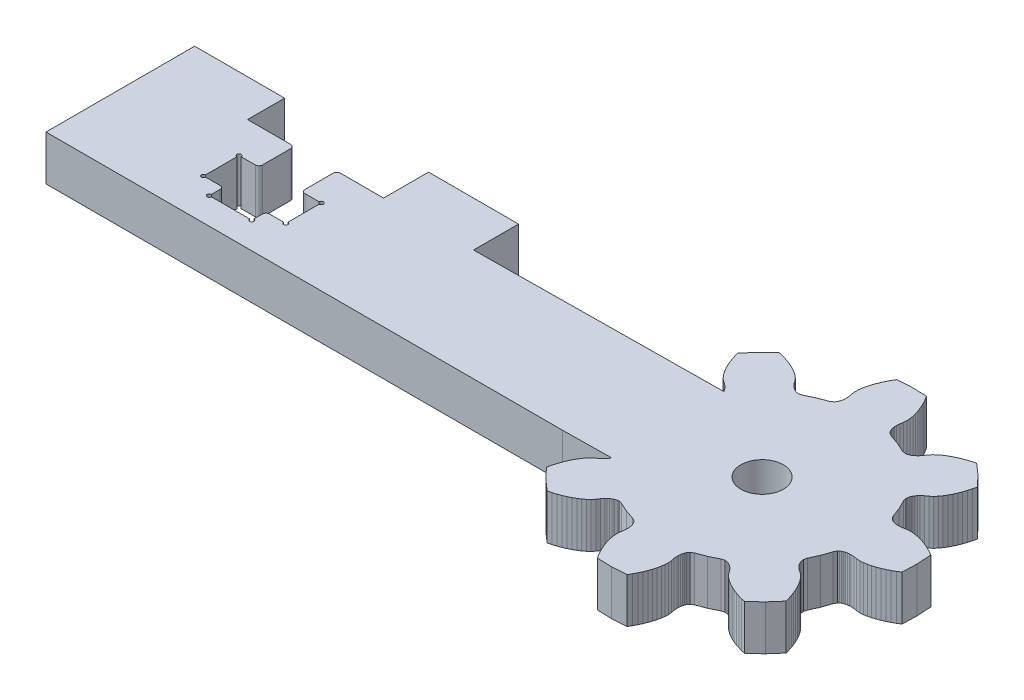
from build123d import *

# Parameters (mm, degrees)
SKETCH1_R           = 1.500100003
BOSS_EXTRUDE1_DEPTH = 3.175


with BuildPart() as part:
    # Sketch1 → Boss-Extrude1 (new body)
    with BuildSketch(Plane(origin=(0, 0, 0), x_dir=(1, 0, 0), z_dir=(0, 1, 0))):
        with BuildLine():
            Line((63.490660584, 166.135437226), (63.490660584, 169.310437226))
            Line((63.490660584, 169.310437226), (57.140660584, 169.310437226))
            Line((57.140660584, 169.310437226), (57.140660584, 166.135437226))
            Line((57.140660584, 166.135437226), (54.090660584, 166.135437226))
            ThreePointArc((54.090660584, 166.135437226), (53.913883889, 166.062213921), (53.840660584, 165.885437226))
            Line((53.840660584, 165.885437226), (53.840660584, 163.885437226))
            ThreePointArc((53.840660584, 163.885437226), (53.913883889, 163.70866053), (54.090660584, 163.635437226))
            Line((54.090660584, 163.635437226), (55.090660584, 163.635437226))
            ThreePointArc((55.090660584, 163.635437226), (55.346726602, 163.741503243), (55.240660584, 163.485437226))
            Line((55.240660584, 163.485437226), (55.240660584, 161.285437226))
            ThreePointArc((55.240660584, 161.285437226), (55.346726602, 161.029371208), (55.090660584, 161.135437226))
            Line((55.090660584, 161.135437226), (54.090660584, 161.135437226))
            ThreePointArc((54.090660584, 161.135437226), (53.913883889, 161.062213921), (53.840660584, 160.885437226))
            Line((53.840660584, 160.885437226), (53.840660584, 160.285437226))
            ThreePointArc((53.840660584, 160.285437226), (53.946726602, 160.029371208), (53.690660584, 160.135437226))
            Line((53.690660584, 160.135437226), (50.990660584, 160.135437226))
            ThreePointArc((50.990660584, 160.135437226), (50.734594567, 160.029371208), (50.840660584, 160.285437226))
            Line((50.840660584, 160.285437226), (50.840660584, 160.885437226))
            ThreePointArc((50.840660584, 160.885437226), (50.76743728, 161.062213921), (50.590660584, 161.135437226))
            Line((50.590660584, 161.135437226), (49.590660584, 161.135437226))
            ThreePointArc((49.590660584, 161.135437226), (49.334594567, 161.029371208), (49.440660584, 161.285437226))
            Line((49.440660584, 161.285437226), (49.440660584, 163.485437226))
            ThreePointArc((49.440660584, 163.485437226), (49.334594567, 163.741503243), (49.590660584, 163.635437226))
            Line((49.590660584, 163.635437226), (50.590660584, 163.635437226))
            ThreePointArc((50.590660584, 163.635437226), (50.76743728, 163.70866053), (50.840660584, 163.885437226))
            Line((50.840660584, 163.885437226), (50.840660584, 165.885437226))
            ThreePointArc((50.840660584, 165.885437226), (50.76743728, 166.062213921), (50.590660584, 166.135437226))
            Line((50.590660584, 166.135437226), (47.540660584, 166.135437226))
            Line((47.540660584, 166.135437226), (47.540660584, 168.752887226))
            Line((47.540660584, 168.752887226), (41.190660584, 168.752887226))
            Line((41.190660584, 168.752887226), (41.190660584, 158.261337226))
            Line((41.190660584, 158.261337226), (77.647660584, 158.261337226))
            Line((77.647660584, 158.261337226), (81.024260584, 158.305437226))
            Line((81.024260584, 158.305437226), (81.057760584, 158.271437226))
            Line((81.057760584, 158.271437226), (80.991260584, 158.164237226))
            Line((80.991260584, 158.164237226), (80.917560584, 158.068737226))
            Line((80.917560584, 158.068737226), (80.838160584, 157.982137226))
            Line((80.838160584, 157.982137226), (80.665660584, 157.829737226))
            Line((80.665660584, 157.829737226), (80.478460584, 157.699537226))
            Line((80.478460584, 157.699537226), (80.305460584, 157.548237226))
            Line((80.305460584, 157.548237226), (80.152060584, 157.368237226))
            Line((80.152060584, 157.368237226), (80.011560584, 157.170537226))
            Line((80.011560584, 157.170537226), (79.882660584, 156.957837226))
            Line((79.882660584, 156.957837226), (79.764560584, 156.732137226))
            Line((79.764560584, 156.732137226), (79.657060584, 156.494337226))
            Line((79.657060584, 156.494337226), (79.560160584, 156.245637226))
            Line((79.560160584, 156.245637226), (79.473860584, 155.986537226))
            Line((79.473860584, 155.986537226), (79.398260584, 155.717737226))
            Line((79.398260584, 155.717737226), (79.333560584, 155.439937226))
            Line((79.333560584, 155.439937226), (80.040460584, 154.686037226))
            Line((80.040460584, 154.686037226), (80.816160584, 154.003137226))
            Line((80.816160584, 154.003137226), (81.091860584, 154.076537226))
            Line((81.091860584, 154.076537226), (81.358160584, 154.160537226))
            Line((81.358160584, 154.160537226), (81.614360584, 154.254937226))
            Line((81.614360584, 154.254937226), (81.859960584, 154.359637226))
            Line((81.859960584, 154.359637226), (82.094260584, 154.474537226))
            Line((82.094260584, 154.474537226), (82.316160584, 154.599637226))
            Line((82.316160584, 154.599637226), (82.524660584, 154.735237226))
            Line((82.524660584, 154.735237226), (82.717960584, 154.881737226))
            Line((82.717960584, 154.881737226), (82.892960584, 155.040737226))
            Line((82.892960584, 155.040737226), (83.038760584, 155.218437226))
            Line((83.038760584, 155.218437226), (83.162960584, 155.409637226))
            Line((83.162960584, 155.409637226), (83.309860584, 155.586837226))
            Line((83.309860584, 155.586837226), (83.393960584, 155.668937226))
            Line((83.393960584, 155.668937226), (83.487160584, 155.745637226))
            Line((83.487160584, 155.745637226), (83.592160584, 155.815337226))
            Line((83.592160584, 155.815337226), (83.650660584, 155.846937226))
            Line((83.650660584, 155.846937226), (83.714560584, 155.875537226))
            Line((83.714560584, 155.875537226), (83.785660584, 155.900137226))
            Line((83.785660584, 155.900137226), (83.867860584, 155.918937226))
            Line((83.867860584, 155.918937226), (83.970460584, 155.926937226))
            Line((83.970460584, 155.926937226), (84.191860584, 155.874037226))
            Line((84.191860584, 155.874037226), (84.834860584, 155.583037226))
            Line((84.834860584, 155.583037226), (85.502760584, 155.354937226))
            Line((85.502760584, 155.354937226), (85.700460584, 155.242037226))
            Line((85.700460584, 155.242037226), (85.769760584, 155.165837226))
            Line((85.769760584, 155.165837226), (85.816760584, 155.095937226))
            Line((85.816760584, 155.095937226), (85.851760584, 155.029337226))
            Line((85.851760584, 155.029337226), (85.878760584, 154.964737226))
            Line((85.878760584, 154.964737226), (85.899860584, 154.901737226))
            Line((85.899860584, 154.901737226), (85.928660584, 154.778937226))
            Line((85.928660584, 154.778937226), (85.944060584, 154.659237226))
            Line((85.944060584, 154.659237226), (85.949160584, 154.541837226))
            Line((85.949160584, 154.541837226), (85.934960584, 154.312137226))
            Line((85.934960584, 154.312137226), (85.894660584, 154.087737226))
            Line((85.894660584, 154.087737226), (85.879260584, 153.858437226))
            Line((85.879260584, 153.858437226), (85.898060584, 153.622637226))
            Line((85.898060584, 153.622637226), (85.938560584, 153.383537226))
            Line((85.938560584, 153.383537226), (85.997760584, 153.141937226))
            Line((85.997760584, 153.141937226), (86.073860584, 152.898837226))
            Line((86.073860584, 152.898837226), (86.165960584, 152.654737226))
            Line((86.165960584, 152.654737226), (86.273360584, 152.410337226))
            Line((86.273360584, 152.410337226), (86.395560584, 152.166037226))
            Line((86.395560584, 152.166037226), (86.532160584, 151.922637226))
            Line((86.532160584, 151.922637226), (86.682860584, 151.680437226))
            Line((86.682860584, 151.680437226), (87.715860584, 151.647137226))
            Line((87.715860584, 151.647137226), (88.747160584, 151.712837226))
            Line((88.747160584, 151.712837226), (88.890260584, 151.959637226))
            Line((88.890260584, 151.959637226), (89.019060584, 152.207237226))
            Line((89.019060584, 152.207237226), (89.133560584, 152.455237226))
            Line((89.133560584, 152.455237226), (89.233160584, 152.702937226))
            Line((89.233160584, 152.702937226), (89.317560584, 152.949737226))
            Line((89.317560584, 152.949737226), (89.386060584, 153.195237226))
            Line((89.386060584, 153.195237226), (89.437660584, 153.438537226))
            Line((89.437660584, 153.438537226), (89.470660584, 153.678837226))
            Line((89.470660584, 153.678837226), (89.481960584, 153.914937226))
            Line((89.481960584, 153.914937226), (89.459360584, 154.143737226))
            Line((89.459360584, 154.143737226), (89.412060584, 154.366737226))
            Line((89.412060584, 154.366737226), (89.390660584, 154.595937226))
            Line((89.390660584, 154.595937226), (89.392060584, 154.713437226))
            Line((89.392060584, 154.713437226), (89.403760584, 154.833537226))
            Line((89.403760584, 154.833537226), (89.428660584, 154.957137226))
            Line((89.428660584, 154.957137226), (89.447760584, 155.020837226))
            Line((89.447760584, 155.020837226), (89.472660584, 155.086237226))
            Line((89.472660584, 155.086237226), (89.505560584, 155.153937226))
            Line((89.505560584, 155.153937226), (89.550360584, 155.225237226))
            Line((89.550360584, 155.225237226), (89.617260584, 155.303537226))
            Line((89.617260584, 155.303537226), (89.811260584, 155.422637226))
            Line((89.811260584, 155.422637226), (90.471660584, 155.671637226))
            Line((90.471660584, 155.671637226), (91.105160584, 155.982637226))
            Line((91.105160584, 155.982637226), (91.324860584, 156.042437226))
            Line((91.324860584, 156.042437226), (91.427760584, 156.037637226))
            Line((91.427760584, 156.037637226), (91.510460584, 156.021537226))
            Line((91.510460584, 156.021537226), (91.582360584, 155.999137226))
            Line((91.582360584, 155.999137226), (91.647060584, 155.972537226))
            Line((91.647060584, 155.972537226), (91.706460584, 155.942837226))
            Line((91.706460584, 155.942837226), (91.813660584, 155.876337226))
            Line((91.813660584, 155.876337226), (91.909160584, 155.802637226))
            Line((91.909160584, 155.802637226), (91.995860584, 155.723237226))
            Line((91.995860584, 155.723237226), (92.148160584, 155.550837226))
            Line((92.148160584, 155.550837226), (92.278460584, 155.363637226))
            Line((92.278460584, 155.363637226), (92.429660584, 155.190537226))
            Line((92.429660584, 155.190537226), (92.609660584, 155.037137226))
            Line((92.609660584, 155.037137226), (92.807360584, 154.896737226))
            Line((92.807360584, 154.896737226), (93.020060584, 154.767737226))
            Line((93.020060584, 154.767737226), (93.245760584, 154.649637226))
            Line((93.245760584, 154.649637226), (93.483560584, 154.542237226))
            Line((93.483560584, 154.542237226), (93.732360584, 154.445337226))
            Line((93.732360584, 154.445337226), (93.991360584, 154.359037226))
            Line((93.991360584, 154.359037226), (94.260160584, 154.283437226))
            Line((94.260160584, 154.283437226), (94.538060584, 154.218737226))
            Line((94.538060584, 154.218737226), (95.291960584, 154.925537226))
            Line((95.291960584, 154.925537226), (95.974760584, 155.701337226))
            Line((95.974760584, 155.701337226), (95.901360584, 155.976937226))
            Line((95.901360584, 155.976937226), (95.817360584, 156.243237226))
            Line((95.817360584, 156.243237226), (95.722960584, 156.499537226))
            Line((95.722960584, 156.499537226), (95.618360584, 156.745137226))
            Line((95.618360584, 156.745137226), (95.503460584, 156.979337226))
            Line((95.503460584, 156.979337226), (95.378260584, 157.201337226))
            Line((95.378260584, 157.201337226), (95.242660584, 157.409737226))
            Line((95.242660584, 157.409737226), (95.096160584, 157.603037226))
            Line((95.096160584, 157.603037226), (94.937160584, 157.778037226))
            Line((94.937160584, 157.778037226), (94.759460584, 157.923837226))
            Line((94.759460584, 157.923837226), (94.568260584, 158.048137226))
            Line((94.568260584, 158.048137226), (94.391160584, 158.195037226))
            Line((94.391160584, 158.195037226), (94.309060584, 158.279137226))
            Line((94.309060584, 158.279137226), (94.232360584, 158.372237226))
            Line((94.232360584, 158.372237226), (94.162560584, 158.477337226))
            Line((94.162560584, 158.477337226), (94.130960584, 158.535837226))
            Line((94.130960584, 158.535837226), (94.102460584, 158.599637226))
            Line((94.102460584, 158.599637226), (94.077760584, 158.670837226))
            Line((94.077760584, 158.670837226), (94.059060584, 158.752937226))
            Line((94.059060584, 158.752937226), (94.050960584, 158.855637226))
            Line((94.050960584, 158.855637226), (94.103860584, 159.077037226))
            Line((94.103860584, 159.077037226), (94.394860584, 159.720037226))
            Line((94.394860584, 159.720037226), (94.622960584, 160.387937226))
            Line((94.622960584, 160.387937226), (94.735960584, 160.585537226))
            Line((94.735960584, 160.585537226), (94.812060584, 160.654937226))
            Line((94.812060584, 160.654937226), (94.881960584, 160.701937226))
            Line((94.881960584, 160.701937226), (94.948660584, 160.736937226))
            Line((94.948660584, 160.736937226), (95.013160584, 160.763937226))
            Line((95.013160584, 160.763937226), (95.076160584, 160.784937226))
            Line((95.076160584, 160.784937226), (95.198960584, 160.813737226))
            Line((95.198960584, 160.813737226), (95.318660584, 160.829137226))
            Line((95.318660584, 160.829137226), (95.436060584, 160.834237226))
            Line((95.436060584, 160.834237226), (95.665760584, 160.820137226))
            Line((95.665760584, 160.820137226), (95.890260584, 160.779837226))
            Line((95.890260584, 160.779837226), (96.119560584, 160.764437226))
            Line((96.119560584, 160.764437226), (96.355260584, 160.783137226))
            Line((96.355260584, 160.783137226), (96.594360584, 160.823737226))
            Line((96.594360584, 160.823737226), (96.835960584, 160.882937226))
            Line((96.835960584, 160.882937226), (97.079060584, 160.959037226))
            Line((97.079060584, 160.959037226), (97.323160584, 161.051137226))
            Line((97.323160584, 161.051137226), (97.567660584, 161.158537226))
            Line((97.567660584, 161.158537226), (97.811860584, 161.280637226))
            Line((97.811860584, 161.280637226), (98.055360584, 161.417337226))
            Line((98.055360584, 161.417337226), (98.297560584, 161.568037226))
            Line((98.297560584, 161.568037226), (98.330760584, 162.600937226))
            Line((98.330760584, 162.600937226), (98.265160584, 163.632337226))
            Line((98.265160584, 163.632337226), (98.018260584, 163.775337226))
            Line((98.018260584, 163.775337226), (97.770660584, 163.904237226))
            Line((97.770660584, 163.904237226), (97.522660584, 164.018637226))
            Line((97.522660584, 164.018637226), (97.274960584, 164.118337226))
            Line((97.274960584, 164.118337226), (97.028160584, 164.202737226))
            Line((97.028160584, 164.202737226), (96.782760584, 164.271237226))
            Line((96.782760584, 164.271237226), (96.539460584, 164.322737226))
            Line((96.539460584, 164.322737226), (96.299160584, 164.355737226))
            Line((96.299160584, 164.355737226), (96.062960584, 164.367137226))
            Line((96.062960584, 164.367137226), (95.834160584, 164.344537226))
            Line((95.834160584, 164.344537226), (95.611160584, 164.297237226))
            Line((95.611160584, 164.297237226), (95.381960584, 164.275837226))
            Line((95.381960584, 164.275837226), (95.264460584, 164.277237226))
            Line((95.264460584, 164.277237226), (95.144360584, 164.288837226))
            Line((95.144360584, 164.288837226), (95.020760584, 164.313837226))
            Line((95.020760584, 164.313837226), (94.957060584, 164.332837226))
            Line((94.957060584, 164.332837226), (94.891760584, 164.357837226))
            Line((94.891760584, 164.357837226), (94.823960584, 164.390637226))
            Line((94.823960584, 164.390637226), (94.752660584, 164.435437226))
            Line((94.752660584, 164.435437226), (94.674360584, 164.502437226))
            Line((94.674360584, 164.502437226), (94.555260584, 164.696437226))
            Line((94.555260584, 164.696437226), (94.306360584, 165.356837226))
            Line((94.306360584, 165.356837226), (93.995360584, 165.990337226))
            Line((93.995360584, 165.990337226), (93.935460584, 166.210037226))
            Line((93.935460584, 166.210037226), (93.940260584, 166.312837226))
            Line((93.940260584, 166.312837226), (93.956460584, 166.395537226))
            Line((93.956460584, 166.395537226), (93.978760584, 166.467437226))
            Line((93.978760584, 166.467437226), (94.005360584, 166.532137226))
            Line((94.005360584, 166.532137226), (94.035060584, 166.591537226))
            Line((94.035060584, 166.591537226), (94.101560584, 166.698837226))
            Line((94.101560584, 166.698837226), (94.175260584, 166.794337226))
            Line((94.175260584, 166.794337226), (94.254660584, 166.880937226))
            Line((94.254660584, 166.880937226), (94.427060584, 167.033337226))
            Line((94.427060584, 167.033337226), (94.614360584, 167.163537226))
            Line((94.614360584, 167.163537226), (94.787360584, 167.314837226))
            Line((94.787360584, 167.314837226), (94.940760584, 167.494737226))
            Line((94.940760584, 167.494737226), (95.081160584, 167.692537226))
            Line((95.081160584, 167.692537226), (95.210160584, 167.905137226))
            Line((95.210160584, 167.905137226), (95.328260584, 168.130937226))
            Line((95.328260584, 168.130937226), (95.435660584, 168.368637226))
            Line((95.435660584, 168.368637226), (95.532660584, 168.617437226))
            Line((95.532660584, 168.617437226), (95.618860584, 168.876537226))
            Line((95.618860584, 168.876537226), (95.694460584, 169.145337226))
            Line((95.694460584, 169.145337226), (95.759160584, 169.423137226))
            Line((95.759160584, 169.423137226), (95.052360584, 170.177037226))
            Line((95.052360584, 170.177037226), (94.276560584, 170.859837226))
            Line((94.276560584, 170.859837226), (94.000960584, 170.786437226))
            Line((94.000960584, 170.786437226), (93.734660584, 170.702537226))
            Line((93.734660584, 170.702537226), (93.478360584, 170.608137226))
            Line((93.478360584, 170.608137226), (93.232760584, 170.503437226))
            Line((93.232760584, 170.503437226), (92.998560584, 170.388537226))
            Line((92.998560584, 170.388537226), (92.776660584, 170.263437226))
            Line((92.776660584, 170.263437226), (92.568160584, 170.127837226))
            Line((92.568160584, 170.127837226), (92.374860584, 169.981237226))
            Line((92.374860584, 169.981237226), (92.199860584, 169.822337226))
            Line((92.199860584, 169.822337226), (92.054060584, 169.644537226))
            Line((92.054060584, 169.644537226), (91.929760584, 169.453337226))
            Line((91.929760584, 169.453337226), (91.782860584, 169.276237226))
            Line((91.782860584, 169.276237226), (91.698860584, 169.194137226))
            Line((91.698860584, 169.194137226), (91.605660584, 169.117437226))
            Line((91.605660584, 169.117437226), (91.500560584, 169.047637226))
            Line((91.500560584, 169.047637226), (91.442160584, 169.016137226))
            Line((91.442160584, 169.016137226), (91.378260584, 168.987537226))
            Line((91.378260584, 168.987537226), (91.307160584, 168.962937226))
            Line((91.307160584, 168.962937226), (91.224960584, 168.944137226))
            Line((91.224960584, 168.944137226), (91.122260584, 168.936137226))
            Line((91.122260584, 168.936137226), (90.900860584, 168.989037226))
            Line((90.900860584, 168.989037226), (90.257860584, 169.280037226))
            Line((90.257860584, 169.280037226), (89.589960584, 169.508037226))
            Line((89.589960584, 169.508037226), (89.392360584, 169.621037226))
            Line((89.392360584, 169.621037226), (89.323060584, 169.697137226))
            Line((89.323060584, 169.697137226), (89.275960584, 169.767137226))
            Line((89.275960584, 169.767137226), (89.240960584, 169.833737226))
            Line((89.240960584, 169.833737226), (89.213960584, 169.898237226))
            Line((89.213960584, 169.898237226), (89.192960584, 169.961337226))
            Line((89.192960584, 169.961337226), (89.164160584, 170.084137226))
            Line((89.164160584, 170.084137226), (89.148760584, 170.203837226))
            Line((89.148760584, 170.203837226), (89.143660584, 170.321237226))
            Line((89.143660584, 170.321237226), (89.157860584, 170.550837226))
            Line((89.157860584, 170.550837226), (89.198060584, 170.775337226))
            Line((89.198060584, 170.775337226), (89.213560584, 171.004637226))
            Line((89.213560584, 171.004637226), (89.194760584, 171.240337226))
            Line((89.194760584, 171.240337226), (89.154260584, 171.479537226))
            Line((89.154260584, 171.479537226), (89.095060584, 171.721037226))
            Line((89.095060584, 171.721037226), (89.018860584, 171.964237226))
            Line((89.018860584, 171.964237226), (88.926760584, 172.208237226))
            Line((88.926760584, 172.208237226), (88.819460584, 172.452737226))
            Line((88.819460584, 172.452737226), (88.697260584, 172.696937226))
            Line((88.697260584, 172.696937226), (88.560660584, 172.940437226))
            Line((88.560660584, 172.940437226), (88.409860584, 173.182637226))
            Line((88.409860584, 173.182637226), (87.376960584, 173.215937226))
            Line((87.376960584, 173.215937226), (86.345660584, 173.150237226))
            Line((86.345660584, 173.150237226), (86.202560584, 172.903437226))
            Line((86.202560584, 172.903437226), (86.073660584, 172.655737226))
            Line((86.073660584, 172.655737226), (85.959260584, 172.407837226))
            Line((85.959260584, 172.407837226), (85.859560584, 172.160137226))
            Line((85.859560584, 172.160137226), (85.775160584, 171.913237226))
            Line((85.775160584, 171.913237226), (85.706760584, 171.667837226))
            Line((85.706760584, 171.667837226), (85.655160584, 171.424537226))
            Line((85.655160584, 171.424537226), (85.622160584, 171.184237226))
            Line((85.622160584, 171.184237226), (85.610860584, 170.948037226))
            Line((85.610860584, 170.948037226), (85.633360584, 170.719337226))
            Line((85.633360584, 170.719337226), (85.680760584, 170.496237226))
            Line((85.680760584, 170.496237226), (85.702160584, 170.267137226))
            Line((85.702160584, 170.267137226), (85.700660584, 170.149637226))
            Line((85.700660584, 170.149637226), (85.689060584, 170.029537226))
            Line((85.689060584, 170.029537226), (85.664060584, 169.905837226))
            Line((85.664060584, 169.905837226), (85.645060584, 169.842237226))
            Line((85.645060584, 169.842237226), (85.620160584, 169.776837226))
            Line((85.620160584, 169.776837226), (85.587260584, 169.709137226))
            Line((85.587260584, 169.709137226), (85.542460584, 169.637837226))
            Line((85.542460584, 169.637837226), (85.475560584, 169.559537226))
            Line((85.475560584, 169.559537226), (85.281460584, 169.440337226))
            Line((85.281460584, 169.440337226), (84.621160584, 169.191437226))
            Line((84.621160584, 169.191437226), (83.987560584, 168.880437226))
            Line((83.987560584, 168.880437226), (83.767960584, 168.820537226))
            Line((83.767960584, 168.820537226), (83.665060584, 168.825337226))
            Line((83.665060584, 168.825337226), (83.582360584, 168.841537226))
            Line((83.582360584, 168.841537226), (83.510460584, 168.863937226))
            Line((83.510460584, 168.863937226), (83.445760584, 168.890537226))
            Line((83.445760584, 168.890537226), (83.386360584, 168.920137226))
            Line((83.386360584, 168.920137226), (83.279160584, 168.986637226))
            Line((83.279160584, 168.986637226), (83.183560584, 169.060337226))
            Line((83.183560584, 169.060337226), (83.096960584, 169.139837226))
            Line((83.096960584, 169.139837226), (82.944560584, 169.312237226))
            Line((82.944560584, 169.312237226), (82.814360584, 169.499437226))
            Line((82.814360584, 169.499437226), (82.663060584, 169.672437226))
            Line((82.663060584, 169.672437226), (82.483160584, 169.825937226))
            Line((82.483160584, 169.825937226), (82.285360584, 169.966337226))
            Line((82.285360584, 169.966337226), (82.072760584, 170.095237226))
            Line((82.072760584, 170.095237226), (81.846960584, 170.213337226))
            Line((81.846960584, 170.213337226), (81.609260584, 170.320837226))
            Line((81.609260584, 170.320837226), (81.360460584, 170.417737226))
            Line((81.360460584, 170.417737226), (81.101360584, 170.504037226))
            Line((81.101360584, 170.504037226), (80.832660584, 170.579637226))
            Line((80.832660584, 170.579637226), (80.554760584, 170.644337226))
            Line((80.554760584, 170.644337226), (79.800860584, 169.937437226))
            Line((79.800860584, 169.937437226), (79.118060584, 169.161737226))
            Line((79.118060584, 169.161737226), (79.191460584, 168.886037226))
            Line((79.191460584, 168.886037226), (79.275360584, 168.619737226))
            Line((79.275360584, 168.619737226), (79.369860584, 168.363537226))
            Line((79.369860584, 168.363537226), (79.474460584, 168.117937226))
            Line((79.474460584, 168.117937226), (79.589360584, 167.883737226))
            Line((79.589360584, 167.883737226), (79.714460584, 167.661737226))
            Line((79.714460584, 167.661737226), (79.850060584, 167.453237226))
            Line((79.850060584, 167.453237226), (79.996660584, 167.259937226))
            Line((79.996660584, 167.259937226), (80.155660584, 167.084937226))
            Line((80.155660584, 167.084937226), (80.333360584, 166.939237226))
            Line((80.333360584, 166.939237226), (80.524560584, 166.814937226))
            Line((80.524560584, 166.814937226), (80.701660584, 166.668037226))
            Line((80.701660584, 166.668037226), (80.783760584, 166.583937226))
            Line((80.783760584, 166.583937226), (80.860460584, 166.490737226))
            Line((80.860460584, 166.490737226), (80.930260584, 166.385737226))
            Line((80.930260584, 166.385737226), (80.961760584, 166.327237226))
            Line((80.961760584, 166.327237226), (80.976260584, 166.317737226))
            Line((80.976260584, 166.317737226), (63.490660584, 166.135437226))
        make_face()
        with Locations((87.546260584, 162.444137226)):
            Circle(SKETCH1_R, mode=Mode.SUBTRACT)
    extrude(amount=BOSS_EXTRUDE1_DEPTH)


solid = part.part
